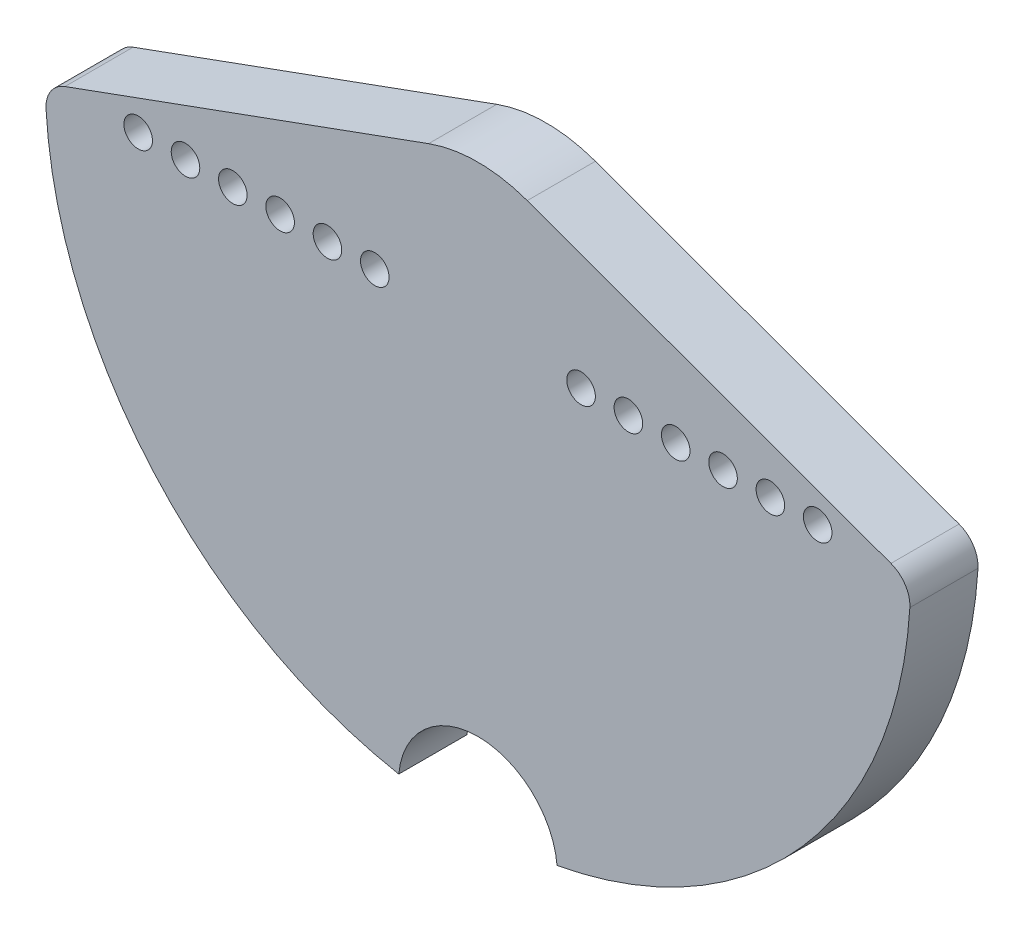
from build123d import *

# Parameters (mm, degrees)
BOSS_EXTRUDE1_DEPTH = 3
SKETCH2_R           = 0.121
SKETCH2_R_2         = 0.629
CUT_EXTRUDE1_DEPTH  = 27.860157637


with BuildPart() as part:
    # Sketch1 → Boss-Extrude1 (new body)
    with BuildSketch(Plane.XY):
        with BuildLine():
            Line((2.17182791, 5.967048142), (18.183098235, 0.139422331))
            ThreePointArc((18.183098235, 0.139422331), (18.810198573, -0.356713964), (19.016499271, -1.129272104))
            ThreePointArc((19.016499271, -1.129272104), (14.283369136, -12.605073031), (3.485200626, -18.72847769))
            ThreePointArc((3.485200626, -18.72847769), (0, -15.55), (-3.485200626, -18.72847769))
            ThreePointArc((-3.485200626, -18.72847769), (-14.283369136, -12.605073031), (-19.016499271, -1.129272104))
            ThreePointArc((-19.016499271, -1.129272104), (-18.810198573, -0.356713964), (-18.183098235, 0.139422331))
            Line((-18.183098235, 0.139422331), (-2.17182791, 5.967048142))
            ThreePointArc((-2.17182791, 5.967048142), (0, 6.35), (2.17182791, 5.967048142))
        make_face()
    extrude(amount=BOSS_EXTRUDE1_DEPTH)

    # Sketch2 → Cut-Extrude1 (cut, symmetric)
    with BuildSketch(Plane.XY.offset(3)):
        with Locations((10.791666667, 0)):
            Circle(SKETCH2_R)
        with Locations((8.708333333, 0)):
            Circle(SKETCH2_R)
        with Locations((6.625, 0)):
            Circle(SKETCH2_R)
        with Locations((-12.875, 0)):
            Circle(SKETCH2_R_2)
        with Locations((-14.958333333, 0)):
            Circle(SKETCH2_R_2)
        with Locations((-4.541666667, 0)):
            Circle(SKETCH2_R_2)
        with Locations((-6.625, 0)):
            Circle(SKETCH2_R_2)
        with Locations((-8.708333333, 0)):
            Circle(SKETCH2_R_2)
        with Locations((-10.791666667, 0)):
            Circle(SKETCH2_R_2)
        with Locations((4.541666667, 0)):
            Circle(SKETCH2_R)
        with Locations((14.958333333, 0)):
            Circle(SKETCH2_R)
        with Locations((12.875, 0)):
            Circle(SKETCH2_R)
    cut_extrude1 = extrude(amount=CUT_EXTRUDE1_DEPTH, both=True, mode=Mode.SUBTRACT)

    # Mirror1: Cut-Extrude1 across plane
    add(cut_extrude1.mirror(Plane(origin=(0, 0, 0), x_dir=(0, 0, 1), z_dir=(1, 0, 0))), mode=Mode.SUBTRACT)


solid = part.part
